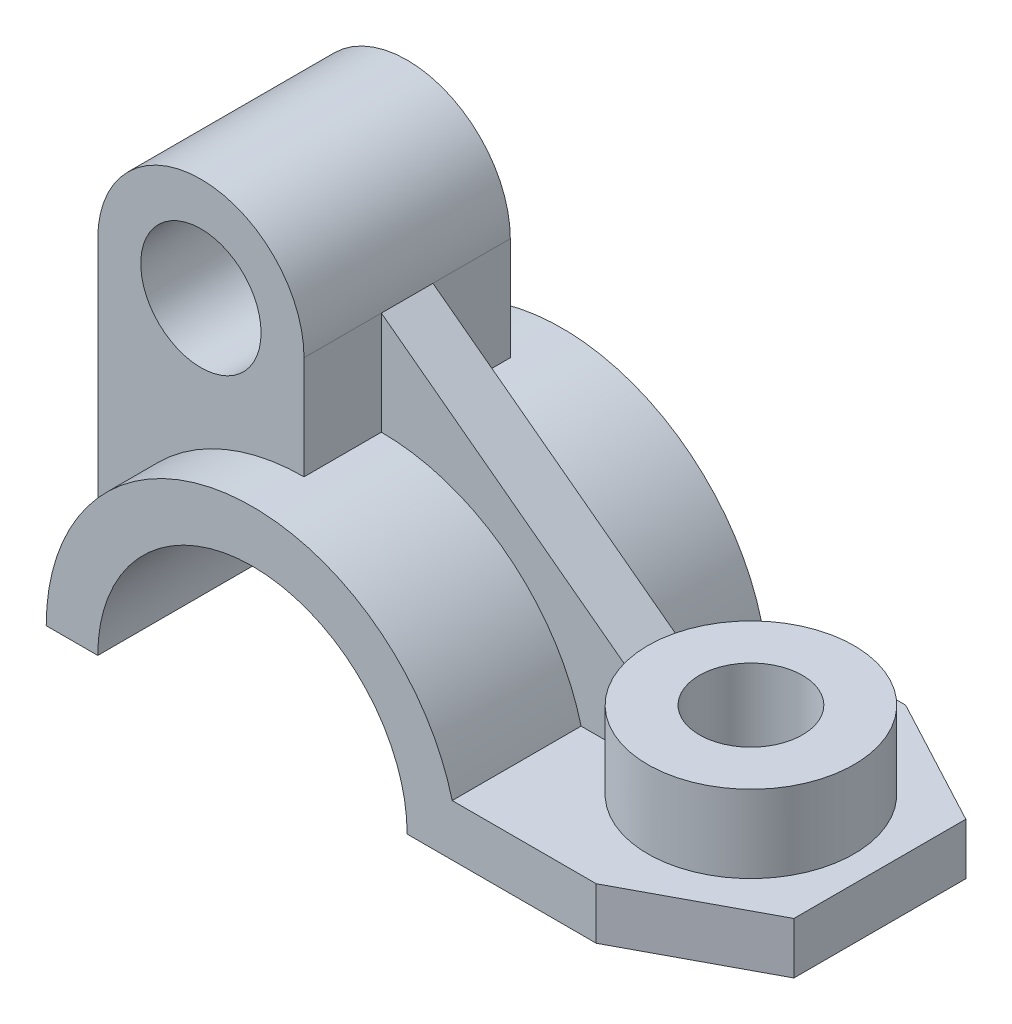
from build123d import *
from build123d.topology import SkipClean

# Parameters (mm, degrees)
BOSS_EXTRUDE1_DEPTH = 18
SKETCH1_3_R         = 7
BOSS_EXTRUDE2_DEPTH = 12
SKETCH2_R           = 12
SKETCH2_R_2         = 6
BOSS_EXTRUDE3_DEPTH = 9
RIB1_START          = -3
RIB1_DEPTH          = 6
CHAMFER1_SIZE       = 8
CHAMFER1_SIZE2      = 15
CHAMFER2_SIZE       = 15
CHAMFER2_SIZE2      = 8
SKETCH2_2_R         = 6
CUT_EXTRUDE1_DEPTH  = 72.505244563


# Read off the part's stored shape, not the designer's step: Rib1
with BuildPart() as part:
    # Sketch1 → Boss-Extrude1 (new, symmetric)
    with BuildSketch(Plane.XY):
        with BuildLine():
            Line((18, 0), (24, 0))
            ThreePointArc((24, 0), (0, 24), (-24, 0))
            Line((-24, 0), (-18, 0))
            ThreePointArc((-18, 0), (0, 18), (18, 0))
        make_face()
        with BuildLine():
            Line((55, 6), (23.237900077, 6))
            ThreePointArc((23.237900077, 6), (23.80871271, 3.02410302), (24, 0))
            Line((24, 0), (55, 0))
            Line((55, 0), (55, 6))
        make_face()
    extrude(amount=BOSS_EXTRUDE1_DEPTH, both=True)

    # Sketch1<3> → Boss-Extrude2 (add, symmetric)
    with BuildSketch(Plane.XY):
        with BuildLine():
            Line((-24, 36), (-24, 0))
            ThreePointArc((-24, 0), (-16.970562748, 16.970562748), (0, 24))
            Line((0, 24), (0, 36))
            ThreePointArc((0, 36), (-12, 48), (-24, 36))
        make_face()
        with Locations((-12, 36)):
            Circle(SKETCH1_3_R, mode=Mode.SUBTRACT)
    extrude(amount=BOSS_EXTRUDE2_DEPTH, both=True)

    # Sketch2 → Boss-Extrude3 (add)
    with BuildSketch(Plane(origin=(0, 6, 0), x_dir=(1, 0, 0), z_dir=(0, 1, 0))):
        with Locations((40, 0)):
            Circle(SKETCH2_R)
        with Locations(Location((40, 0, 0), (0, 0, 180))):
            Circle(SKETCH2_R_2, mode=Mode.SUBTRACT)
    extrude(amount=BOSS_EXTRUDE3_DEPTH)

    # Rib1 outline → Rib1 (add)
    with SkipClean():  # the faces are left unmerged after this step: merging them gives an invalid solid
        with BuildSketch(Plane.XY.offset(RIB1_START)):
            with BuildLine():
                Line((28.381049961, 14.714212529), (0, 36))
                Line((0, 36), (0, 24))
                ThreePointArc((0, 24), (14.696938456, 18.973665961), (23.237900077, 6))
                Line((23.237900077, 6), (30, 6))
                Line((30, 6), (30, 13.5))
                Line((30, 13.5), (28.381049961, 14.714212529))
            make_face()
        extrude(amount=RIB1_DEPTH)

    # Chamfer1
    chamfer1_edges = [part.edges().sort_by_distance(p)[0] for p in [
        (55, 3, 18),
    ]]
    chamfer1_side = [part.faces().sort_by_distance(p)[0] for p in [
        (55, 3, 0),
    ]]
    chamfer(chamfer1_edges, length=CHAMFER1_SIZE, length2=CHAMFER1_SIZE2, reference=chamfer1_side[0])

    # Chamfer2
    chamfer2_edges = [part.edges().sort_by_distance(p)[0] for p in [
        (55, 3, -18),
    ]]
    chamfer2_side = [part.faces().sort_by_distance(p)[0] for p in [
        (36.5, 0.825651258, -18),
    ]]
    chamfer(chamfer2_edges, length=CHAMFER2_SIZE, length2=CHAMFER2_SIZE2, reference=chamfer2_side[0])

    # Sketch2<2> → Cut-Extrude1 (cut, through all)
    with BuildSketch(Plane(origin=(0, 6, 0), x_dir=(1, 0, 0), z_dir=(0, 1, 0))):
        with Locations(Location((40, 0, 0), (0, 0, 180))):
            Circle(SKETCH2_2_R)
    extrude(amount=-CUT_EXTRUDE1_DEPTH, mode=Mode.SUBTRACT)


solid = part.part
